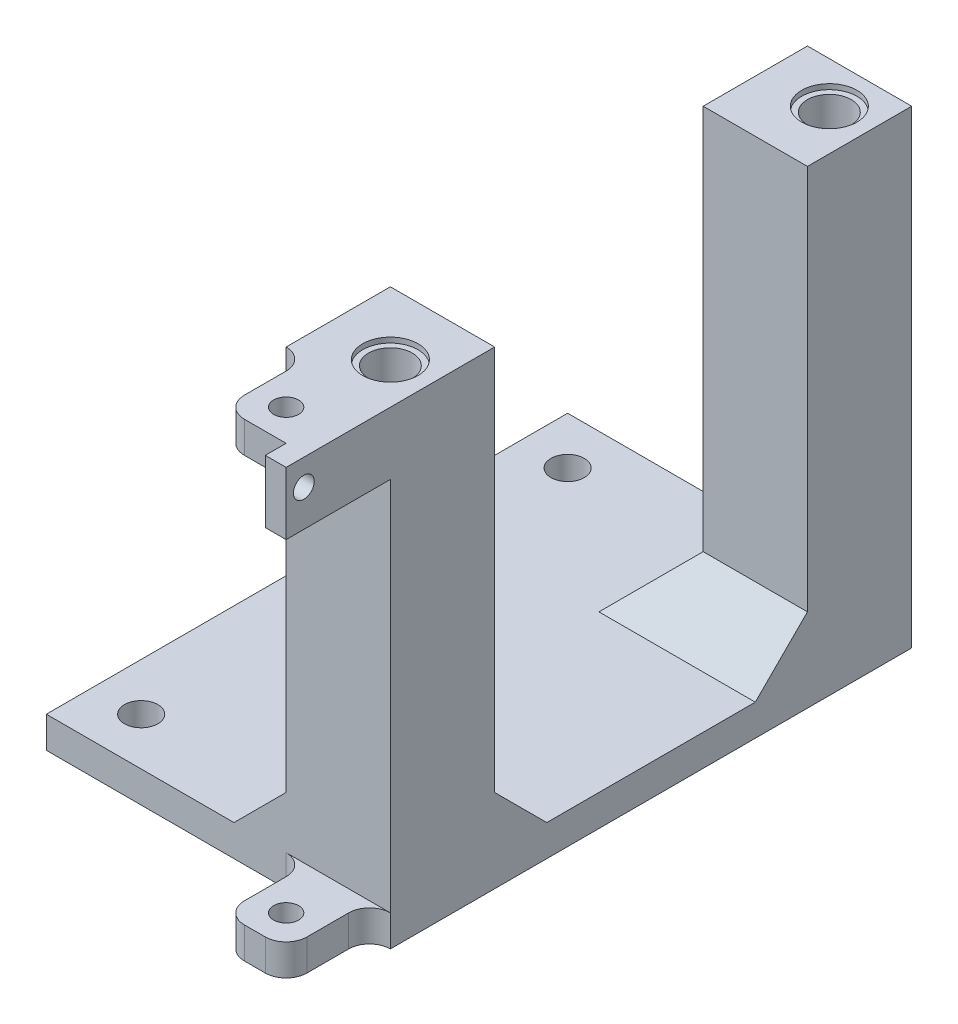
from build123d import *

# Parameters (mm, degrees)
SKETCH1_R           = 1.6
BOSS_EXTRUDE1_DEPTH = 3
SKETCH2_W           = 10
SKETCH2_H           = 10
BOSS_EXTRUDE2_DEPTH = 42
CHAMFER1_SIZE       = 5
SKETCH3_R           = 2.1
CUT_EXTRUDE1_DEPTH  = 52
SKETCH4_R           = 2.65
CUT_EXTRUDE2_DEPTH  = 0.5
SKETCH11_W          = 6
SKETCH11_H          = 3
BOSS_EXTRUDE7_DEPTH = 8
SKETCH12_R          = 1.2
CUT_EXTRUDE5_DEPTH  = 72.139584736
FILLET1_R           = 2
SKETCH13_W          = 2
SKETCH13_H          = 3
BOSS_EXTRUDE8_DEPTH = 10
SKETCH14_W          = 2
SKETCH14_H          = 10
BOSS_EXTRUDE9_DEPTH = 3
SKETCH15_R          = 1
CUT_EXTRUDE6_DEPTH  = 3


with BuildPart() as part:
    # Sketch1 → Boss-Extrude1 (new body)
    with BuildSketch(Plane(origin=(0, 0, 0), x_dir=(1, 0, 0), z_dir=(0, 1, 0))):
        Polygon((-6.512396694, 9.685950413), (1.487603306, 9.685950413), (26.487603306, 9.685950413), (26.487603306, -40.314049587), (1.487603306, -40.314049587), (-6.512396694, -40.314049587), align=None)
        with Locations(Location((-1.962396694, -35.764049587, 0), (0, 0, 270))):
            Circle(SKETCH1_R, mode=Mode.SUBTRACT)
        with Locations(Location((-1.962396694, 5.135950413, 0), (0, 0, 270))):
            Circle(SKETCH1_R, mode=Mode.SUBTRACT)
    extrude(amount=BOSS_EXTRUDE1_DEPTH)

    # Sketch2 → Boss-Extrude2 (add)
    with BuildSketch(Plane(origin=(0, 3, 0), x_dir=(1, 0, 0), z_dir=(0, 1, 0))):
        with Locations((21.487603306, -35.314049587)):
            Rectangle(SKETCH2_W, SKETCH2_H)
        with Locations((21.487603306, 4.685950413)):
            Rectangle(SKETCH2_W, SKETCH2_H)
    extrude(amount=BOSS_EXTRUDE2_DEPTH)

    # Chamfer1
    chamfer1_edges = [part.edges().sort_by_distance(p)[0] for p in [
        (21.487603306, 3, 30.314049587),
        (16.487603306, 3, 35.314049587),
        (16.487603306, 3, -4.685950413),
        (21.487603306, 3, 0.314049587),
    ]]
    chamfer(chamfer1_edges, length=CHAMFER1_SIZE)

    # Sketch3 → Cut-Extrude1 (cut)
    with BuildSketch(Plane(origin=(0, 45, 0), x_dir=(1, 0, 0), z_dir=(0, 1, 0))):
        with Locations(Location((22.537603306, -36.364049587, 0), (0, 0, 270))):
            Circle(SKETCH3_R)
        with Locations(Location((22.537603306, 5.735950413, 0), (0, 0, 270))):
            Circle(SKETCH3_R)
    extrude(amount=-CUT_EXTRUDE1_DEPTH, mode=Mode.SUBTRACT)

    # Sketch4 → Cut-Extrude2 (cut)
    with BuildSketch(Plane(origin=(0, 45, 0), x_dir=(1, 0, 0), z_dir=(0, 1, 0))):
        with Locations(Location((22.537603306, -36.364049587, 0), (0, 0, 270))):
            Circle(SKETCH4_R)
        with Locations(Location((22.537603306, 5.735950413, 0), (0, 0, 270))):
            Circle(SKETCH4_R)
    cut_extrude2 = extrude(amount=-CUT_EXTRUDE2_DEPTH, mode=Mode.SUBTRACT)

    # Mirror1: Cut-Extrude2 across plane
    add(cut_extrude2.mirror(Plane(origin=(0, 22.5, 0), x_dir=(0, 0, 1), z_dir=(0, -1, 0))), mode=Mode.SUBTRACT)

    # Sketch11 → Boss-Extrude7 (add)
    with BuildSketch(Plane.XY.offset(40.314049587)):
        with Locations((21.487603306, 43.5)):
            Rectangle(SKETCH11_W, SKETCH11_H)
        with Locations((21.487603306, 1.5)):
            Rectangle(SKETCH11_W, SKETCH11_H)
    extrude(amount=BOSS_EXTRUDE7_DEPTH)

    # Sketch12 → Cut-Extrude5 (cut, through all)
    with BuildSketch(Plane.XZ):
        with Locations(Location((21.487603306, 45.314049587, 0), (0, 0, 270))):
            Circle(SKETCH12_R)
    extrude(amount=-CUT_EXTRUDE5_DEPTH, mode=Mode.SUBTRACT)

    # Fillet1
    fillet1_edges = [part.edges().sort_by_distance(p)[0] for p in [
        (18.487603306, 43.5, 40.314049587),
        (18.487603306, 1.5, 40.314049587),
        (24.487603306, 1.5, 40.314049587),
    ]]
    fillet(fillet1_edges, radius=FILLET1_R - 0.0001)  # a hair under: the kernel refuses the full size
    fillet1_2_edges = [part.edges().sort_by_distance(p)[0] for p in [
        (18.487603306, 43.5, 48.314049587),
        (24.487603306, 1.5, 48.314049587),
        (18.487603306, 1.5, 48.314049587),
    ]]
    fillet(fillet1_2_edges, radius=FILLET1_R)

    # Sketch13 → Boss-Extrude8 (add)
    with BuildSketch(Plane.XY.offset(40.314049587)):
        with Locations((25.487603306, 43.5)):
            Rectangle(SKETCH13_W, SKETCH13_H)
    extrude(amount=BOSS_EXTRUDE8_DEPTH)

    # Sketch14 → Boss-Extrude9 (add)
    with BuildSketch(Plane.XZ.offset(-42)):
        with Locations((25.487603306, 45.314049587)):
            Rectangle(SKETCH14_W, SKETCH14_H)
    extrude(amount=BOSS_EXTRUDE9_DEPTH)

    # Sketch15 → Cut-Extrude6 (cut)
    with BuildSketch(Plane(origin=(26.487603306, 0, 0), x_dir=(0, 0, -1), z_dir=(1, 0, 0))):
        with Locations((-48.614049587, 42.5)):
            Circle(SKETCH15_R)
    extrude(amount=-CUT_EXTRUDE6_DEPTH, mode=Mode.SUBTRACT)


solid = part.part
